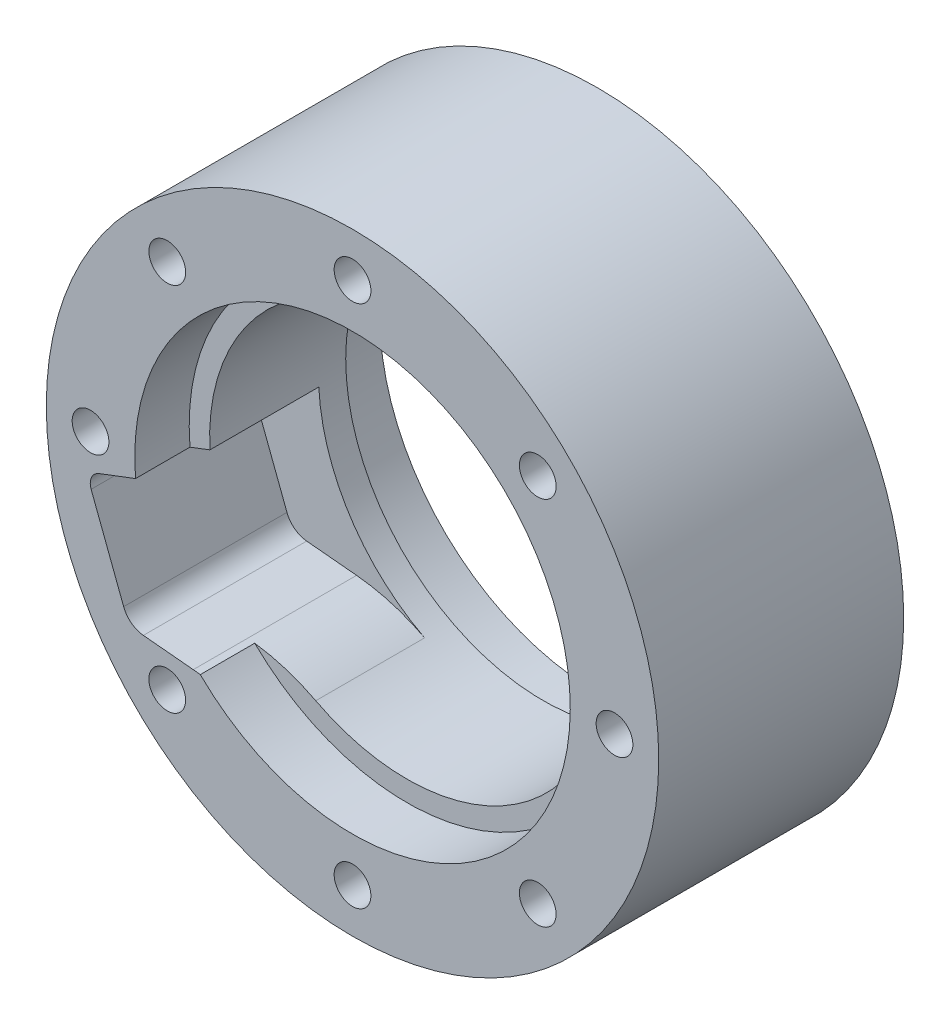
from build123d import *

# Parameters (mm, degrees)
SKETCH3_R               = 1.35
CUT_EXTRUDE2_DEPTH      = 34.068111528
CUT_EXTRUDE4_START      = -2.5
SKETCH4_R               = 2.25
CUT_EXTRUDE4_DEPTH      = 40.058172821
CHAMFER1_SIZE           = 0.1
CIRPATTERN3_COUNT       = 4
CIRPATTERN2_COUNT       = 8
CUT_EXTRUDE6_DEPTH      = 10
CUT_EXTRUDE6_DEPTH_BACK = 3


with BuildPart() as part:
    # Sketch7 → Revolve1 (revolve)
    with BuildSketch(Plane(origin=(0, 0, 0), x_dir=(1, 0, 0), z_dir=(0, 1, 0))):
        Polygon((16, 9), (16, 5), (14.5, 5), (14.5, -5), (16, -5), (16, -9), (22.5, -9), (22.5, 9), align=None)
    revolve(axis=Axis((0, 0, 9.9), (0, 0, -1)))

    # Sketch3 → Cut-Extrude2 (cut, symmetric)
    with BuildSketch(Plane.XY):
        with Locations((0, 19.25)):
            Circle(SKETCH3_R)
    cut_extrude2 = extrude(amount=CUT_EXTRUDE2_DEPTH, both=True, mode=Mode.SUBTRACT)

    # Sketch4 → Cut-Extrude4 (cut)
    with BuildSketch(Plane(origin=(0, 0, -9), x_dir=(-1, 0, 0), z_dir=(0, 0, -1)).offset(CUT_EXTRUDE4_START)):
        with Locations((0, 19.25)):
            Circle(SKETCH4_R)
    cut_extrude4 = extrude(amount=CUT_EXTRUDE4_DEPTH, mode=Mode.SUBTRACT)

    # Chamfer1
    chamfer1_edges = [part.edges().sort_by_distance(p)[0] for p in [
        (-1.35, 19.25, -6.5),
    ]]
    chamfer(chamfer1_edges, length=CHAMFER1_SIZE)

    # CirPattern3: Cut-Extrude4 ×4 about axis
    cirpattern3_axis = Axis((0, 0, 9.9), (0, 0, -1))
    for i in range(1, CIRPATTERN3_COUNT):
        add(cut_extrude4.rotate(cirpattern3_axis, i * 360 / CIRPATTERN3_COUNT), mode=Mode.SUBTRACT)

    # CirPattern2: Cut-Extrude2 ×8 about axis
    cirpattern2_axis = Axis((0, 0, 9.9), (0, 0, -1))
    for i in range(1, CIRPATTERN2_COUNT):
        add(cut_extrude2.rotate(cirpattern2_axis, i * 360 / CIRPATTERN2_COUNT), mode=Mode.SUBTRACT)

    # Sketch11 → Cut-Extrude6 (cut, two sides: drawn at the far end of the back side and taken through both)
    with BuildSketch(Plane.XY.offset(-CUT_EXTRUDE6_DEPTH_BACK)):
        with BuildLine():
            Line((-1.571703106, 4.12766736), (0, 0))
            Line((0, 0), (-6.700053707, -12.859209942))
            ThreePointArc((-6.700053707, -12.859209942), (-9.12915194, -11.878234382), (-11.701320242, -11.381463306))
            Line((-11.701320242, -11.381463306), (-15.367916717, -11.034790639))
            ThreePointArc((-15.367916717, -11.034790639), (-16.249568007, -10.690348228), (-16.816357177, -9.932258782))
            Line((-16.816357177, -9.932258782), (-19.205818349, -3.656963627))
            ThreePointArc((-19.205818349, -3.656963627), (-19.183719897, -2.891915853), (-18.627123464, -2.366571349))
            Line((-18.627123464, -2.366571349), (-1.571703106, 4.12766736))
        make_face()
    extrude(amount=CUT_EXTRUDE6_DEPTH + CUT_EXTRUDE6_DEPTH_BACK, mode=Mode.SUBTRACT)


solid = part.part
